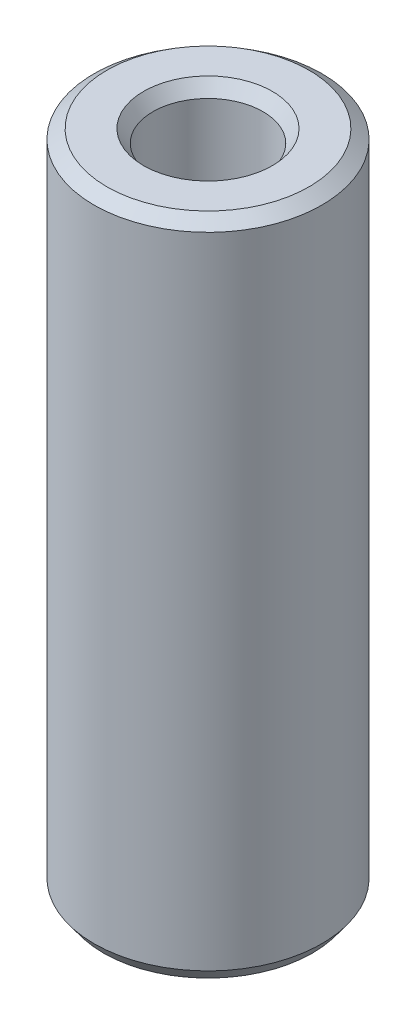
from build123d import *
from OCP.BRepFilletAPI import BRepFilletAPI_MakeChamfer

# Parameters (mm, degrees)
SKETCH1_R           = 42.5
BOSS_EXTRUDE1_DEPTH = 246.938451469
SKETCH2_R           = 20.521250989
CUT_EXTRUDE1_DEPTH  = 255.147789316
CHAMFER1_SIZE       = 3.50483581
CHAMFER1_SIZE2      = 4.79494173


with BuildPart() as part:
    # Sketch1 → Boss-Extrude1 (new body)
    with BuildSketch(Plane(origin=(0, 0, 0), x_dir=(1, 0, 0), z_dir=(0, 1, 0))):
        Circle(SKETCH1_R)
    extrude(amount=BOSS_EXTRUDE1_DEPTH)

    # Sketch2 → Cut-Extrude1 (cut, through all)
    with BuildSketch(Plane(origin=(0, 0, 0), x_dir=(1, 0, 0), z_dir=(0, 1, 0))):
        Circle(SKETCH2_R)
    extrude(amount=CUT_EXTRUDE1_DEPTH, mode=Mode.SUBTRACT)

    # Chamfer1: one chamfer whose edges measure the first distance from different faces: ONE call of the kernel's chamfer builder (chamfer() names one face for all edges)
    chamfer1_edges_1 = [part.edges().sort_by_distance(p)[0] for p in [
        (-20.521250989, 246.938451469, 0),
    ]]
    chamfer1_side_1 = [part.faces().sort_by_distance(p)[0] for p in [
        (-41.297918472, 246.938451469, 0),
    ]]
    chamfer1_edges_2 = [part.edges().sort_by_distance(p)[0] for p in [
        (-20.521250989, 0, 0),
    ]]
    chamfer1_side_2 = [part.faces().sort_by_distance(p)[0] for p in [
        (-20.521250989, 123.469225735, 0),
    ]]
    chamfer1_edges_3 = [part.edges().sort_by_distance(p)[0] for p in [
        (-42.5, 0, 0),
    ]]
    chamfer1_side_3 = [part.faces().sort_by_distance(p)[0] for p in [
        (-41.297918472, 0, 0),
    ]]
    chamfer1_edges_4 = [part.edges().sort_by_distance(p)[0] for p in [
        (-42.5, 246.938451469, 0),
    ]]
    chamfer1_side_4 = [part.faces().sort_by_distance(p)[0] for p in [
        (-42.5, 123.469225735, 0),
    ]]
    chamfer1 = BRepFilletAPI_MakeChamfer(part.part.solid().wrapped)
    for e in chamfer1_edges_1:
        chamfer1.Add(CHAMFER1_SIZE, CHAMFER1_SIZE2, e.wrapped, chamfer1_side_1[0].wrapped)  # the first distance lies on this face
    for e in chamfer1_edges_2:
        chamfer1.Add(CHAMFER1_SIZE, CHAMFER1_SIZE2, e.wrapped, chamfer1_side_2[0].wrapped)  # the first distance lies on this face
    for e in chamfer1_edges_3:
        chamfer1.Add(CHAMFER1_SIZE, CHAMFER1_SIZE2, e.wrapped, chamfer1_side_3[0].wrapped)  # the first distance lies on this face
    for e in chamfer1_edges_4:
        chamfer1.Add(CHAMFER1_SIZE, CHAMFER1_SIZE2, e.wrapped, chamfer1_side_4[0].wrapped)  # the first distance lies on this face
    add(Compound.cast(chamfer1.Shape()), mode=Mode.REPLACE)


solid = part.part
